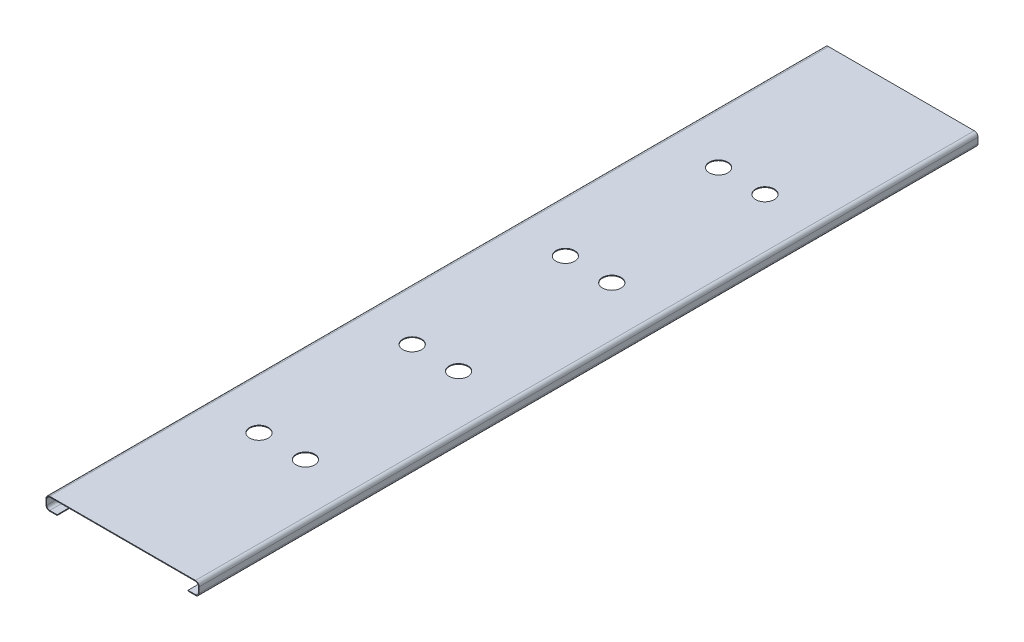
from build123d import *

# Parameters (mm, degrees)
BASE_FLANGE1_DEPTH = 839
SKETCH6_R          = 10
CUT_EXTRUDE1_DEPTH = 10


# Sheet-metal steps are written as plain solids
with BuildPart() as part:
    # Sketch1 → Base-Flange1 (new body)
    with BuildSketch(Plane.XY):
        with BuildLine():
            Line((12, 0), (4, 0))
            ThreePointArc((4, 0), (1.171572875, 1.171572875), (0, 4))
            Line((0, 4), (0, 10))
            ThreePointArc((0, 10), (1.171572875, 12.828427125), (4, 14))
            Line((4, 14), (161, 14))
            ThreePointArc((161, 14), (163.828427125, 12.828427125), (165, 10))
            Line((165, 10), (165, 4))
            ThreePointArc((165, 4), (163.828427125, 1.171572875), (161, 0))
            Line((161, 0), (153, 0))
            Line((153, 0), (153, 0.8))
            Line((153, 0.8), (161, 0.8))
            ThreePointArc((161, 0.8), (163.2627417, 1.7372583), (164.2, 4))
            Line((164.2, 4), (164.2, 10))
            ThreePointArc((164.2, 10), (163.2627417, 12.2627417), (161, 13.2))
            Line((161, 13.2), (4, 13.2))
            ThreePointArc((4, 13.2), (1.7372583, 12.2627417), (0.8, 10))
            Line((0.8, 10), (0.8, 4))
            ThreePointArc((0.8, 4), (1.7372583, 1.7372583), (4, 0.8))
            Line((4, 0.8), (12, 0.8))
            Line((12, 0.8), (12, 0))
        make_face()
    extrude(amount=BASE_FLANGE1_DEPTH)

    # Sketch6 → Cut-Extrude1 (cut)
    with BuildSketch(Plane(origin=(0, 14, 0), x_dir=(1, 0, 0), z_dir=(0, 1, 0))):
        with Locations(Location((107.5, -337, 0), (0, 0, 270))):
            Circle(SKETCH6_R)
        with Locations(Location((107.5, -172, 0), (0, 0, 270))):
            Circle(SKETCH6_R)
        with Locations(Location((107.5, -502, 0), (0, 0, 270))):
            Circle(SKETCH6_R)
        with Locations(Location((107.5, -667, 0), (0, 0, 270))):
            Circle(SKETCH6_R)
        with Locations(Location((57.5, -667, 0), (0, 0, 270))):
            Circle(SKETCH6_R)
        with Locations(Location((57.5, -502, 0), (0, 0, 270))):
            Circle(SKETCH6_R)
        with Locations(Location((57.5, -337, 0), (0, 0, 270))):
            Circle(SKETCH6_R)
        with Locations(Location((57.5, -172, 0), (0, 0, 270))):
            Circle(SKETCH6_R)
    extrude(amount=-CUT_EXTRUDE1_DEPTH, mode=Mode.SUBTRACT)


solid = part.part
